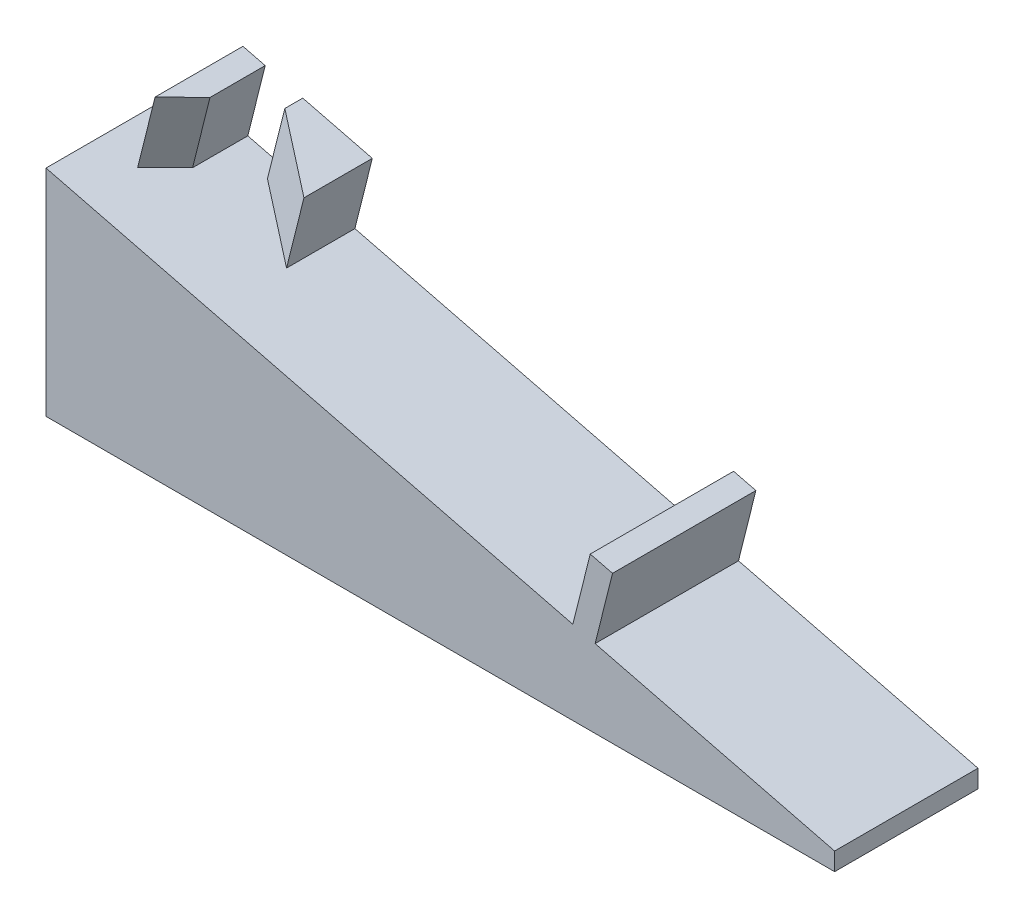
from build123d import *

# Parameters (mm, degrees)
BOSS_EXTRUDE1_DEPTH      = 10
BOSS_EXTRUDE1_DEPTH_BACK = 10
SKETCH2_W                = 3.2
SKETCH2_H                = 20
BOSS_EXTRUDE2_DEPTH      = 10
CUT_EXTRUDE1_START       = -5.2
CUT_EXTRUDE1_DEPTH       = 5.2


# Read off the part's stored shape, not the designer's step: Cut-Extrude1
with BuildPart() as part:
    # Sketch1 → Boss-Extrude1 (new, two sides: drawn at the far end of the back side and taken through both)
    with BuildSketch(Plane.XY.offset(-BOSS_EXTRUDE1_DEPTH_BACK)):
        Polygon((-55, 21.875), (55, -5.625), (55, -8.125), (-55, -8.125), align=None)
    extrude(amount=BOSS_EXTRUDE1_DEPTH + BOSS_EXTRUDE1_DEPTH_BACK)

    # Sketch2 → Boss-Extrude2 (add)
    with BuildSketch(Plane(origin=(1.911764706, 7.647058824, 0), x_dir=(0.970142500145332, -0.24253562503633289, 0), z_dir=(0.24253562503633289, 0.970142500145332, 0))):
        Polygon((-53.463304306, 10), (-50.263304306, 10), (-50.263304306, 2.29875108), (-53.463304306, -2.25), align=None)
        Polygon((-44.863304306, 10), (-44.863304306, 7.5), (-34.863304306, 0.465101973), (-34.863304306, 10), align=None)
        with Locations((18.686695694, 0)):
            Rectangle(SKETCH2_W, SKETCH2_H)
    extrude(amount=BOSS_EXTRUDE2_DEPTH)

    # Cut-Extrude1 outline → Cut-Extrude1 (cut)
    with BuildSketch(Plane.XZ.offset(8.125).offset(CUT_EXTRUDE1_START)):
        Polygon((-14.11294757, -4.9), (-22.553719096, -4.9), (-20.992494606, -10), (-15.67417206, -10), align=None)
        Polygon((14.11294757, -4.9), (15.67417206, -10), (20.992494606, -10), (22.553719096, -4.9), align=None)
    extrude(amount=CUT_EXTRUDE1_DEPTH, mode=Mode.SUBTRACT)


solid = part.part
